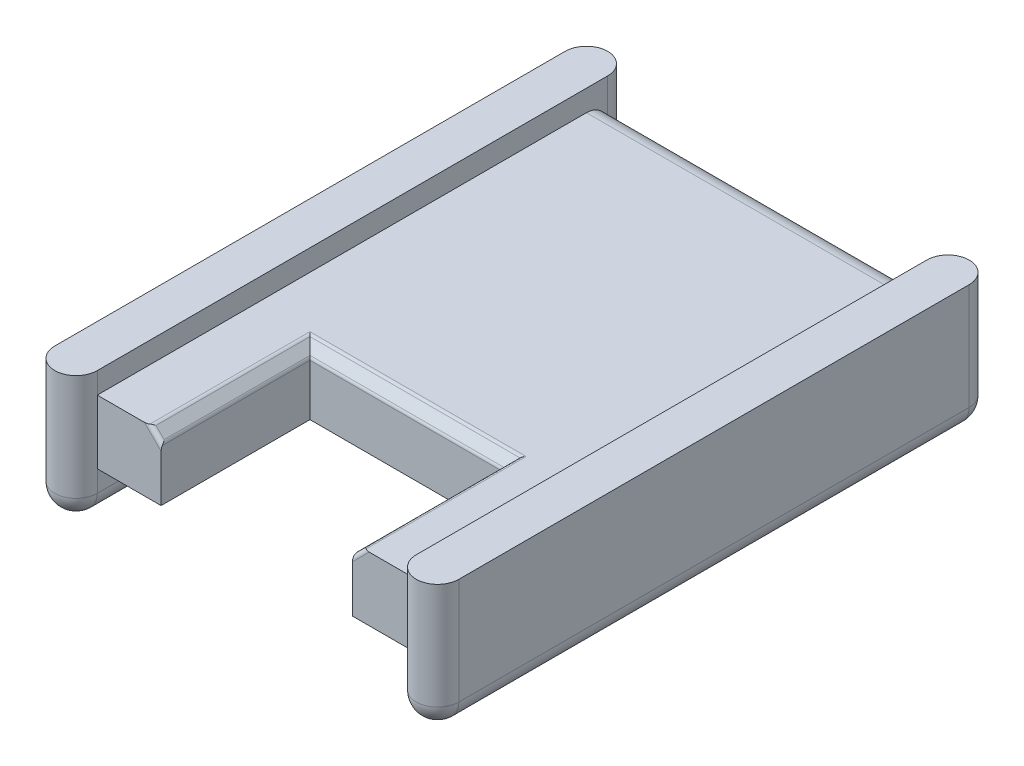
from build123d import *

# Parameters (mm, degrees)
SKETCH1_W                = 750
SKETCH1_H                = 150
BOSS_EXTRUDE1_DEPTH      = 1200
BOSS_EXTRUDE8_DEPTH      = 50
BOSS_EXTRUDE8_DEPTH_BACK = 250
FILLET2_R                = 50
FILLET3_R                = 50
SKETCH6_W                = 450
SKETCH6_H                = 350
CUT_EXTRUDE1_DEPTH       = 250
CHAMFER1_SIZE            = 25
CHAMFER2_SIZE            = 25
FILLET4_R                = 10


with BuildPart() as part:
    # Sketch1 → Boss-Extrude1 (new body)
    with BuildSketch(Plane.XY):
        with Locations((375, 75)):
            Rectangle(SKETCH1_W, SKETCH1_H)
    extrude(amount=-BOSS_EXTRUDE1_DEPTH)

    # Sketch2 → Boss-Extrude8 (add, two sides: drawn at the far end of the back side and taken through both)
    with BuildSketch(Plane(origin=(0, 150, 0), x_dir=(1, 0, 0), z_dir=(0, 1, 0)).offset(-BOSS_EXTRUDE8_DEPTH_BACK)):
        with BuildLine():
            Line((0, 1200), (0, 0))
            ThreePointArc((0, 0), (-50, -50), (-100, 0))
            Line((-100, 0), (-100, 1200))
            ThreePointArc((-100, 1200), (-50, 1250), (0, 1200))
        make_face()
        with BuildLine():
            Line((850, 1200), (850, 0))
            ThreePointArc((850, 0), (800, -50), (750, 0))
            Line((750, 0), (750, 1200))
            ThreePointArc((750, 1200), (800, 1250), (850, 1200))
        make_face()
    extrude(amount=BOSS_EXTRUDE8_DEPTH + BOSS_EXTRUDE8_DEPTH_BACK)

    # Fillet2
    fillet2_edges = [part.edges().sort_by_distance(p)[0] for p in [
        (-50, -100, -1250),
        (-100, -100, -600),
        (-50, -100, 50),
        (0, -100, -600),
        (800, -100, 50),
        (850, -100, -600),
        (800, -100, -1250),
        (750, -100, -600),
    ]]
    fillet(fillet2_edges, radius=FILLET2_R - 0.0001)  # a hair under: the kernel refuses the full size

    # Fillet3
    fillet3_edges = [part.edges().sort_by_distance(p)[0] for p in [
        (375, 150, -1200),
        (375, 0, -1200),
    ]]
    fillet(fillet3_edges, radius=FILLET3_R)

    # Sketch6 → Cut-Extrude1 (cut)
    with BuildSketch(Plane(origin=(0, 150, 0), x_dir=(1, 0, 0), z_dir=(0, 1, 0))):
        with Locations((375, 175)):
            Rectangle(SKETCH6_W, SKETCH6_H)
    extrude(amount=-CUT_EXTRUDE1_DEPTH, mode=Mode.SUBTRACT)

    # Chamfer1
    chamfer1_edges = [part.edges().sort_by_distance(p)[0] for p in [
        (375, 150, -350),
    ]]
    chamfer(chamfer1_edges, length=CHAMFER1_SIZE)

    # Chamfer2
    chamfer2_edges = [part.edges().sort_by_distance(p)[0] for p in [
        (150, 150, -187.5),
        (600, 150, -187.5),
    ]]
    chamfer(chamfer2_edges, length=CHAMFER2_SIZE)

    # Fillet4
    fillet4_edges = [part.edges().sort_by_distance(p)[0] for p in [
        (375, 125, -350),
        (375, 150, -375),
        (150, 125, -175),
        (137.5, 137.5, 0),
        (625, 150, -187.5),
        (125, 150, -187.5),
        (600, 125, -175),
        (612.5, 137.5, 0),
    ]]
    fillet(fillet4_edges, radius=FILLET4_R)


solid = part.part
